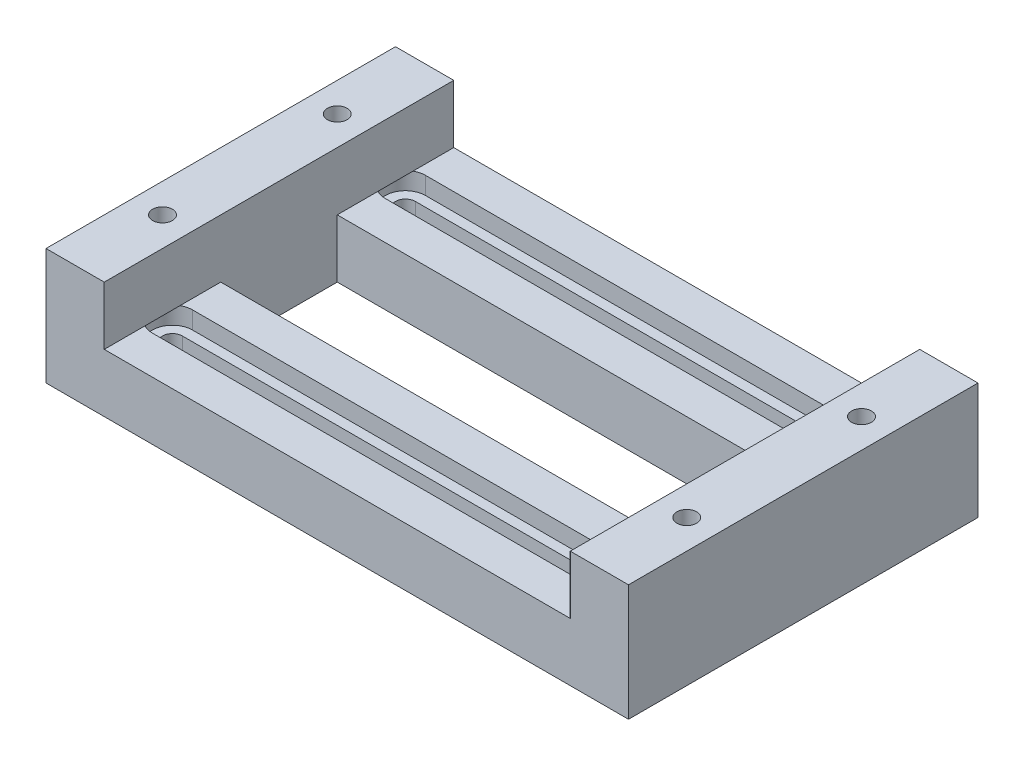
from build123d import *

# Parameters (mm, degrees)
SKETCH1_R             = 1.7
BOSS_EXTRUDE1_DEPTH   = 10
CUT_SLOT_INSETS_DEPTH = 3
SKETCH5_W             = 10
SKETCH5_H             = 60
SKETCH5_R             = 1.7
BOSS_EXTRUDE3_DEPTH   = 10
SKETCH6_R             = 3.75
CUT_EXTRUDE1_DEPTH    = 2.5
CHAMFER1_SIZE         = 0.5
CHAMFER2_SIZE         = 2


with BuildPart() as part:
    # Sketch1 → Boss-Extrude1 (new body)
    with BuildSketch(Plane(origin=(0, 0, 0), x_dir=(1, 0, 0), z_dir=(0, 1, 0))):
        Polygon((100, 60), (50, 60), (0, 60), (0, 0), (100, 0), align=None)
        with Locations((5, 15)):
            Circle(SKETCH1_R, mode=Mode.SUBTRACT)
        with BuildLine():
            ThreePointArc((11.7, 8.3), (10, 10), (11.7, 11.7))
            Line((11.7, 11.7), (88.3, 11.7))
            ThreePointArc((88.3, 11.7), (90, 10), (88.3, 8.3))
            Line((88.3, 8.3), (11.7, 8.3))
        make_face(mode=Mode.SUBTRACT)
        Polygon((10, 20), (10, 40), (50, 40), (90, 40), (90, 20), align=None, mode=Mode.SUBTRACT)
        with Locations((95, 15)):
            Circle(SKETCH1_R, mode=Mode.SUBTRACT)
        with Locations((5, 45)):
            Circle(SKETCH1_R, mode=Mode.SUBTRACT)
        with BuildLine():
            Line((88.3, 48.3), (50, 48.3))
            Line((50, 48.3), (11.7, 48.3))
            ThreePointArc((11.7, 48.3), (10, 50), (11.7, 51.7))
            Line((11.7, 51.7), (50, 51.7))
            Line((50, 51.7), (88.3, 51.7))
            ThreePointArc((88.3, 51.7), (90, 50), (88.3, 48.3))
        make_face(mode=Mode.SUBTRACT)
        with Locations((95, 45)):
            Circle(SKETCH1_R, mode=Mode.SUBTRACT)
    extrude(amount=BOSS_EXTRUDE1_DEPTH)

    # Sketch3 → Cut-Slot insets (cut)
    with BuildSketch(Plane(origin=(0, 10, 0), x_dir=(1, 0, 0), z_dir=(0, 1, 0))):
        with BuildLine():
            Line((88.3, 13.45), (11.7, 13.45))
            ThreePointArc((11.7, 13.45), (8.25, 10), (11.7, 6.55))
            Line((11.7, 6.55), (88.3, 6.55))
            ThreePointArc((88.3, 6.55), (91.75, 10), (88.3, 13.45))
        make_face()
        with BuildLine():
            Line((88.3, 53.45), (11.7, 53.45))
            ThreePointArc((11.7, 53.45), (8.25, 50), (11.7, 46.55))
            Line((11.7, 46.55), (88.3, 46.55))
            ThreePointArc((88.3, 46.55), (91.75, 50), (88.3, 53.45))
        make_face()
    extrude(amount=-CUT_SLOT_INSETS_DEPTH, mode=Mode.SUBTRACT)

    # Sketch5 → Boss-Extrude3 (add)
    # profile 1 of 2: a face of its own
    with BuildSketch(Plane(origin=(0, 10, 0), x_dir=(1, 0, 0), z_dir=(0, 1, 0))):
        with Locations((5, 30)):
            Rectangle(SKETCH5_W, SKETCH5_H)
        with Locations((5, 15)):
            Circle(SKETCH5_R, mode=Mode.SUBTRACT)
        with Locations((5, 45)):
            Circle(SKETCH5_R, mode=Mode.SUBTRACT)
    # profile 2 of 2: a face of its own
    with BuildSketch(Plane(origin=(0, 10, 0), x_dir=(1, 0, 0), z_dir=(0, 1, 0))):
        with Locations((95, 30)):
            Rectangle(SKETCH5_W, SKETCH5_H)
        with Locations((95, 45)):
            Circle(SKETCH5_R, mode=Mode.SUBTRACT)
        with Locations((95, 15)):
            Circle(SKETCH5_R, mode=Mode.SUBTRACT)
    extrude(amount=BOSS_EXTRUDE3_DEPTH)

    # Sketch6 → Cut-Extrude1 (cut)
    with BuildSketch(Plane.XZ):
        with Locations((5, -45)):
            Circle(SKETCH6_R)
        with Locations((5, -15)):
            Circle(SKETCH6_R)
        with Locations((95, -15)):
            Circle(SKETCH6_R)
        with Locations((95, -45)):
            Circle(SKETCH6_R)
    extrude(amount=-CUT_EXTRUDE1_DEPTH, mode=Mode.SUBTRACT)

    # Chamfer1
    chamfer1_edges = [part.edges().sort_by_distance(p)[0] for p in [
        (50, 0, -51.7),
        (90, 0, -50),
        (10, 0, -50),
        (50, 0, -48.3),
        (50, 0, -8.3),
        (10, 0, -10),
        (90, 0, -10),
        (50, 0, -11.7),
    ]]
    chamfer(chamfer1_edges, length=CHAMFER1_SIZE)

    # Chamfer2
    chamfer2_edges = [part.edges().sort_by_distance(p)[0] for p in [
        (91.25, 2.5, -15),
        (91.25, 2.5, -45),
        (1.25, 2.5, -45),
        (1.25, 2.5, -15),
    ]]
    chamfer(chamfer2_edges, length=CHAMFER2_SIZE)


solid = part.part
